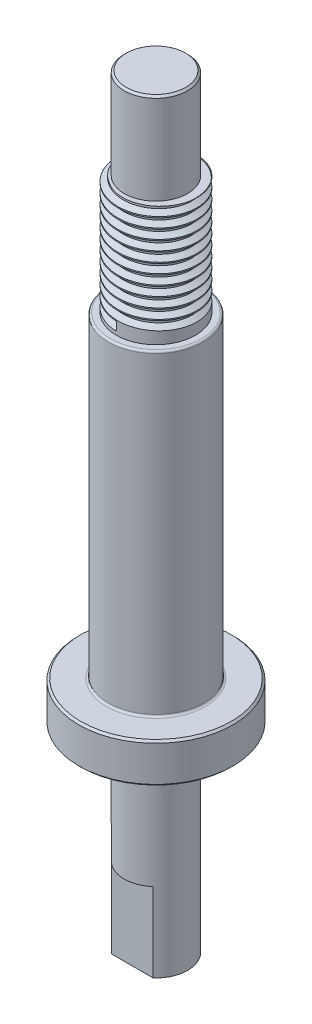
from build123d import *

# Parameters (mm, degrees)
SKETCH1_R           = 9.75
BOSS_EXTRUDE1_DEPTH = 5
SKETCH2_R           = 6
BOSS_EXTRUDE2_DEPTH = 40
SKETCH3_R           = 4
BOSS_EXTRUDE3_DEPTH = 26.5
BOSS_EXTRUDE4_START = 25
SKETCH4_R           = 4
BOSS_EXTRUDE4_DEPTH = 25
CUT_EXTRUDE1_DEPTH  = 10
SKETCH10_R          = 5
SKETCH10_R_2        = 4
BOSS_EXTRUDE5_DEPTH = 15
CUT_SWEEP1_PITCH    = 1.25
FILLET2_R           = 0.25
CUT_EXTRUDE2_DEPTH  = 1
CHAMFER1_SIZE       = 0.25
CHAMFER2_SIZE       = 0.25


with BuildPart() as part:
    # Sketch1 → Boss-Extrude1 (new body)
    with BuildSketch(Plane(origin=(0, 0, 0), x_dir=(1, 0, 0), z_dir=(0, 1, 0))):
        with Locations(Location((0, 0, 0), (0, 0, 270))):
            Circle(SKETCH1_R)
    extrude(amount=BOSS_EXTRUDE1_DEPTH)

    # Sketch2 → Boss-Extrude2 (add)
    with BuildSketch(Plane(origin=(0, 5, 0), x_dir=(1, 0, 0), z_dir=(0, 1, 0))):
        with Locations(Location((0, 0, 0), (0, 0, 270))):
            Circle(SKETCH2_R)
    extrude(amount=BOSS_EXTRUDE2_DEPTH)

    # Sketch3 → Boss-Extrude3 (add)
    with BuildSketch(Plane(origin=(0, 45, 0), x_dir=(1, 0, 0), z_dir=(0, 1, 0))):
        with Locations(Location((0, 0, 0), (0, 0, 270))):
            Circle(SKETCH3_R)
    extrude(amount=BOSS_EXTRUDE3_DEPTH)

    # Sketch4 → Boss-Extrude4 (add)
    with BuildSketch(Plane.XZ.offset(BOSS_EXTRUDE4_START)):
        with Locations(Location((0, 0, 0), (0, 0, 90))):
            Circle(SKETCH4_R)
    extrude(amount=-BOSS_EXTRUDE4_DEPTH)

    # Sketch5 → Cut-Extrude1 (cut)
    with BuildSketch(Plane.XZ.offset(25)):
        with BuildLine():
            Line((-2.645751311, 3), (2.645751311, 3))
            ThreePointArc((2.645751311, 3), (0, 4), (-2.645751311, 3))
        make_face()
    extrude(amount=-CUT_EXTRUDE1_DEPTH, mode=Mode.SUBTRACT)

    # Sketch10 → Boss-Extrude5 (add)
    with BuildSketch(Plane(origin=(0, 45, 0), x_dir=(1, 0, 0), z_dir=(0, 1, 0))):
        with Locations(Location((0, 0, 0), (0, 0, 270))):
            Circle(SKETCH10_R)
        with Locations(Location((0, 0, 0), (0, 0, 270))):
            Circle(SKETCH10_R_2, mode=Mode.SUBTRACT)
    extrude(amount=BOSS_EXTRUDE5_DEPTH)

    # Cut-Sweep1: arcs per turn and ends read off the stored shape
    # Cut-Sweep1: the profile of Sketch14 screwed along a left-hand helix through 12.25 turns, 8 arcs to a turn; built about Z, then put on its axis
    cut_sweep1_z = Axis((0, 0, 0), (0, 0, 1))
    cut_sweep1_corners = [(5.012615432, 0.021545687, 0.541502187), (5.012615432, -0.022852989, -0.57435825), (4.322615432, -0.007014815, -0.17630153), (4.322615432, 0.005707514, 0.143445467)]
    with BuildLine(mode=Mode.PRIVATE) as cut_sweep1_profile:
        Line(cut_sweep1_corners[0], cut_sweep1_corners[1])
        Line(cut_sweep1_corners[1], cut_sweep1_corners[2])
        Line(cut_sweep1_corners[2], cut_sweep1_corners[3])
        Line(cut_sweep1_corners[3], cut_sweep1_corners[0])
    cut_sweep1_cap = Face(cut_sweep1_profile.wire())
    cut_sweep1_turn_angles = [0, -22.5, -45, -67.5, -90, -112.5, -135, -157.5, -180, -202.5, -225, -247.5, -270, -292.5, -315, -337.5, -360]
    cut_sweep1_turn_weights = [1, 0.9238795325112867, 1, 0.9238795325112867, 1, 0.9238795325112867, 1, 0.9238795325112867, 1, 0.9238795325112867, 1, 0.9238795325112867, 1, 0.9238795325112867, 1, 0.9238795325112867, 1]
    cut_sweep1_turn_rails = [Edge.make_bspline([Vector(p[0], p[1], 0).rotate(cut_sweep1_z, cut_sweep1_turn_angles[k]) / cut_sweep1_turn_weights[k] + Vector(0, 0, p[2] + -CUT_SWEEP1_PITCH * cut_sweep1_turn_angles[k] / 360) for k in range(17)], [0, 0, 0, 1, 1, 2, 2, 3, 3, 4, 4, 5, 5, 6, 6, 7, 7, 8, 8, 8], 2, cut_sweep1_turn_weights) for p in cut_sweep1_corners]
    cut_sweep1_turn_sides = [Face.make_surface_from_curves(cut_sweep1_turn_rails[p[0]], cut_sweep1_turn_rails[p[1]]) for p in [(0, 1), (1, 2), (2, 3), (3, 0)]]
    cut_sweep1_last_angles = [-4320, -4342.5, -4365, -4387.5, -4410]
    cut_sweep1_last_weights = [1, 0.9238795325112867, 1, 0.923879532511226, 1]
    cut_sweep1_last_rails = [Edge.make_bspline([Vector(p[0], p[1], 0).rotate(cut_sweep1_z, cut_sweep1_last_angles[k]) / cut_sweep1_last_weights[k] + Vector(0, 0, p[2] + -CUT_SWEEP1_PITCH * cut_sweep1_last_angles[k] / 360) for k in range(5)], [0, 0, 0, 1, 1, 2, 2, 2], 2, cut_sweep1_last_weights) for p in cut_sweep1_corners]
    cut_sweep1_last_sides = [Face.make_surface_from_curves(cut_sweep1_last_rails[p[0]], cut_sweep1_last_rails[p[1]]) for p in [(0, 1), (1, 2), (2, 3), (3, 0)]]
    cut_sweep1 = Plane(origin=(0, 46, 0), x_dir=(0, 0, 1), z_dir=(0, 1, 0)) * Solid(Shell([*[p.moved(Location((0, 0, CUT_SWEEP1_PITCH * i))) for i in range(12) for p in cut_sweep1_turn_sides], *cut_sweep1_last_sides, cut_sweep1_cap, cut_sweep1_cap.rotate(cut_sweep1_z, -4410).moved(Location((0, 0, -CUT_SWEEP1_PITCH * -4410 / 360)))]))
    add(cut_sweep1, mode=Mode.SUBTRACT)

    # Fillet2
    fillet2_edges = [part.edges().sort_by_distance(p)[0] for p in [
        (0, 5, -6),
        (0, 45, -6),
    ]]
    fillet(fillet2_edges, radius=FILLET2_R)

    # Sketch17 → Cut-Extrude2 (cut)
    with BuildSketch(Plane(origin=(0, 45, -6), x_dir=(-1, 0, 0), z_dir=(0, 0, -1))):
        with BuildLine():
            Line((1, -2.8), (1, -38))
            ThreePointArc((1, -38), (0, -39), (-1, -38))
            Line((-1, -38), (-1, -2.8))
            ThreePointArc((-1, -2.8), (0, -1.8), (1, -2.8))
        make_face()
    extrude(amount=-CUT_EXTRUDE2_DEPTH, mode=Mode.SUBTRACT)

    # Chamfer1
    chamfer1_edges = [part.edges().sort_by_distance(p)[0] for p in [
        (0, 71.5, -4),
    ]]
    chamfer(chamfer1_edges, length=CHAMFER1_SIZE)

    # Chamfer2
    chamfer2_edges = [part.edges().sort_by_distance(p)[0] for p in [
        (0, 0, -4),
        (0, 0, -9.75),
        (0, 5, -9.75),
    ]]
    chamfer(chamfer2_edges, length=CHAMFER2_SIZE)


solid = part.part
